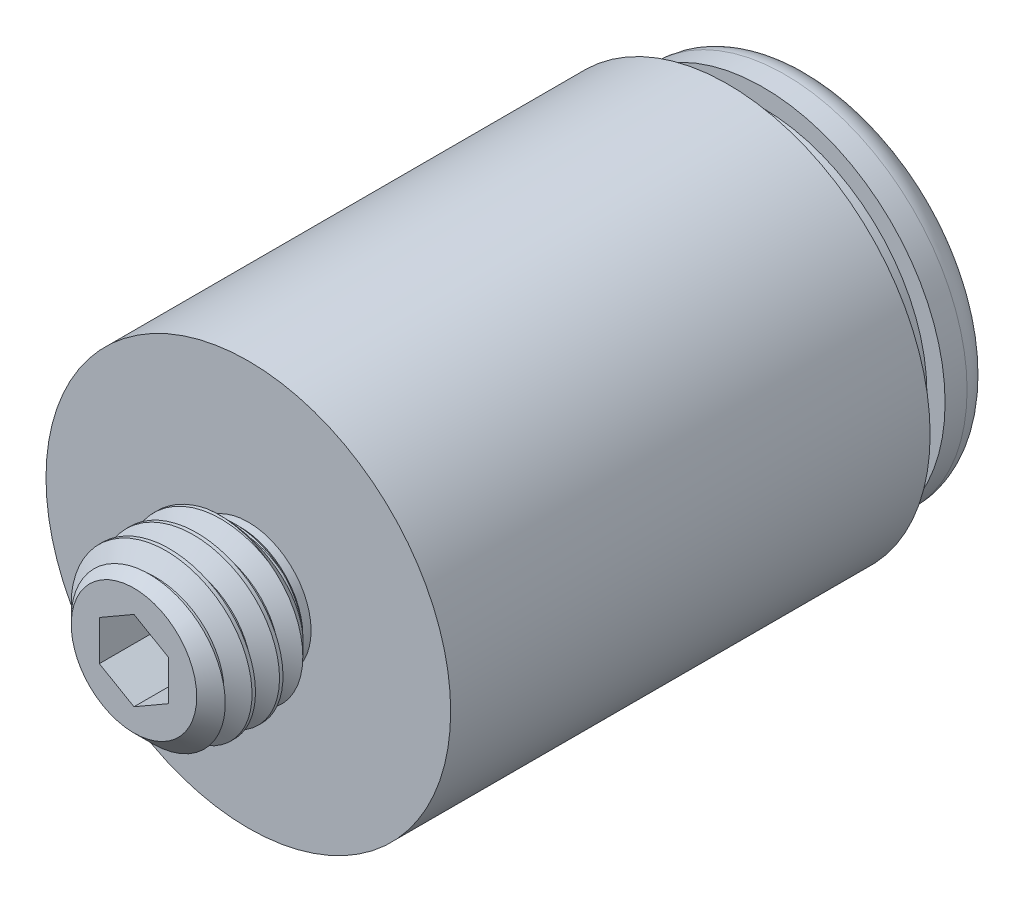
from build123d import *

# Parameters (mm, degrees)
SKETCH1_R          = 2.413
EXTRUDE1_DEPTH     = 3.302
CUT_SWEEP1_PITCH   = 0.79375
SKETCH5_R          = 5.842
EXTRUDE2_DEPTH     = 4.0894
CUT_EXTRUDE3_DEPTH = 15.7066
CUT_EXTRUDE4_START = -2.5654
SKETCH10_R         = 3.175
CUT_EXTRUDE4_DEPTH = 2.5654


with BuildPart() as part:
    # Sketch1 → Extrude1 (new body)
    with BuildSketch(Plane.XY):
        Circle(SKETCH1_R)
    extrude(amount=-EXTRUDE1_DEPTH)

    # Cut-Sweep1: the profile of Sketch3 screwed along a right-hand helix of 6.72 turns, 6 arcs to a turn; built about Z, then put on its axis
    cut_sweep1_z = Axis((0, 0, 0), (0, 0, 1))
    cut_sweep1_corners = [(1.897444252, 0, -0.396875), (1.897444252, 0, -0.29765625), (2.498925958, 0, 0.049609375), (2.455962979, 0, -0.719335937)]
    with BuildLine(mode=Mode.PRIVATE) as cut_sweep1_profile:
        Line(cut_sweep1_corners[0], cut_sweep1_corners[1])
        Line(cut_sweep1_corners[1], cut_sweep1_corners[2])
        Line(cut_sweep1_corners[2], cut_sweep1_corners[3])
        Line(cut_sweep1_corners[3], cut_sweep1_corners[0])
    cut_sweep1_cap = Face(cut_sweep1_profile.wire())
    cut_sweep1_turn_angles = [0, 30, 60, 90, 120, 150, 180, 210, 240, 270, 300, 330, 360]
    cut_sweep1_turn_weights = [1, 0.8660254037844387, 1, 0.8660254037844387, 1, 0.8660254037844387, 1, 0.8660254037844387, 1, 0.8660254037844387, 1, 0.8660254037844387, 1]
    cut_sweep1_turn_rails = [Edge.make_bspline([Vector(p[0], p[1], 0).rotate(cut_sweep1_z, cut_sweep1_turn_angles[k]) / cut_sweep1_turn_weights[k] + Vector(0, 0, p[2] + CUT_SWEEP1_PITCH * cut_sweep1_turn_angles[k] / 360) for k in range(13)], [0, 0, 0, 1, 1, 2, 2, 3, 3, 4, 4, 5, 5, 6, 6, 6], 2, cut_sweep1_turn_weights) for p in cut_sweep1_corners]
    cut_sweep1_turn_sides = [Face.make_surface_from_curves(cut_sweep1_turn_rails[p[0]], cut_sweep1_turn_rails[p[1]]) for p in [(0, 1), (1, 2), (2, 3), (3, 0)]]
    cut_sweep1_last_angles = [2160, 2190, 2220, 2250, 2280, 2310, 2340, 2370, 2400, 2409.6, 2419.2]
    cut_sweep1_last_weights = [1, 0.8660254037844387, 1, 0.8660254037844387, 1, 0.8660254037844387, 1, 0.8660254037844387, 1, 0.9859960370704907, 1]
    cut_sweep1_last_rails = [Edge.make_bspline([Vector(p[0], p[1], 0).rotate(cut_sweep1_z, cut_sweep1_last_angles[k]) / cut_sweep1_last_weights[k] + Vector(0, 0, p[2] + CUT_SWEEP1_PITCH * cut_sweep1_last_angles[k] / 360) for k in range(11)], [0, 0, 0, 1, 1, 2, 2, 3, 3, 4, 4, 5, 5, 5], 2, cut_sweep1_last_weights) for p in cut_sweep1_corners]
    cut_sweep1_last_sides = [Face.make_surface_from_curves(cut_sweep1_last_rails[p[0]], cut_sweep1_last_rails[p[1]]) for p in [(0, 1), (1, 2), (2, 3), (3, 0)]]
    cut_sweep1 = Plane(origin=(0, 0, 0), x_dir=(0, 1, 0), z_dir=(0, 0, -1)) * Solid(Shell([*[p.moved(Location((0, 0, CUT_SWEEP1_PITCH * i))) for i in range(6) for p in cut_sweep1_turn_sides], *cut_sweep1_last_sides, cut_sweep1_cap, cut_sweep1_cap.rotate(cut_sweep1_z, 2419.2).moved(Location((0, 0, CUT_SWEEP1_PITCH * 2419.2 / 360)))]))
    add(cut_sweep1, mode=Mode.SUBTRACT)

    # Sketch4 → Cut-Revolve1 (revolve, cut)
    with BuildSketch(Plane(origin=(0, 0, 0), x_dir=(0, 0, -1), z_dir=(1, 0, 0)), mode=Mode.PRIVATE) as cut_revolve1_sk:
        Polygon((3.302, 1.811518294), (3.063875, 1.811518294), (2.376467336, 2.498925958), (3.302, 2.498925958), align=None)
        Polygon((0.687407664, 2.498925958), (0, 1.811518294), (0, 2.498925958), align=None)
    revolve(cut_revolve1_sk.sketch.rotate(Axis((0, 0, 0), (0, 0, -1)), 90), axis=Axis((0, 0, 0), (0, 0, -1)), mode=Mode.SUBTRACT)

    # Sketch5 → Extrude2 (add)
    with BuildSketch(Plane(origin=(0, 0, -3.302), x_dir=(-1, 0, 0), z_dir=(0, 0, -1))):
        Circle(SKETCH5_R)
    extrude(amount=EXTRUDE2_DEPTH)

    # Sketch8 → Revolve1 (revolve)
    with BuildSketch(Plane(origin=(0, 0, 0), x_dir=(0, 0, -1), z_dir=(1, 0, 0)), mode=Mode.PRIVATE) as revolve1_sk:
        with BuildLine():
            Line((18.161, 5.2578), (18.796, 5.2578))
            ThreePointArc((18.796, 5.2578), (19.334815367, 5.034615367), (19.558, 4.4958))
            Line((19.558, 4.4958), (19.558, 3.556))
            Line((19.558, 3.556), (19.177, 3.175))
            Line((19.177, 3.175), (7.3914, 3.175))
            Line((7.3914, 3.175), (7.3914, 5.842))
            Line((7.3914, 5.842), (17.145, 5.842))
            Line((17.145, 5.842), (17.145, 4.73202))
            Line((17.145, 4.73202), (18.161, 4.73202))
            Line((18.161, 4.73202), (18.161, 5.2578))
        make_face()
    revolve(revolve1_sk.sketch.rotate(Axis((0, 0, 0), (0, 0, -1)), 90), axis=Axis((0, 0, 0), (0, 0, -1)))

    # Sketch9 → Cut-Extrude3 (cut, through all)
    with BuildSketch(Plane(origin=(0, 0, -7.3914), x_dir=(-1, 0, 0), z_dir=(0, 0, -1))):
        Polygon((0, 1.154700575), (-1.000000032, 0.577350288), (-1.000000032, -0.577350288), (0, -1.154700575), (1.000000032, -0.577350288), (1.000000032, 0.577350288), align=None)
    extrude(amount=-CUT_EXTRUDE3_DEPTH, mode=Mode.SUBTRACT)

    # Sketch10 → Cut-Extrude4 (cut)
    with BuildSketch(Plane(origin=(0, 0, -7.3914), x_dir=(-1, 0, 0), z_dir=(0, 0, -1)).offset(CUT_EXTRUDE4_START)):
        with Locations(Location((0, 0, 0), (0, 0, 180))):
            Circle(SKETCH10_R)
    extrude(amount=CUT_EXTRUDE4_DEPTH, mode=Mode.SUBTRACT)


solid = part.part
